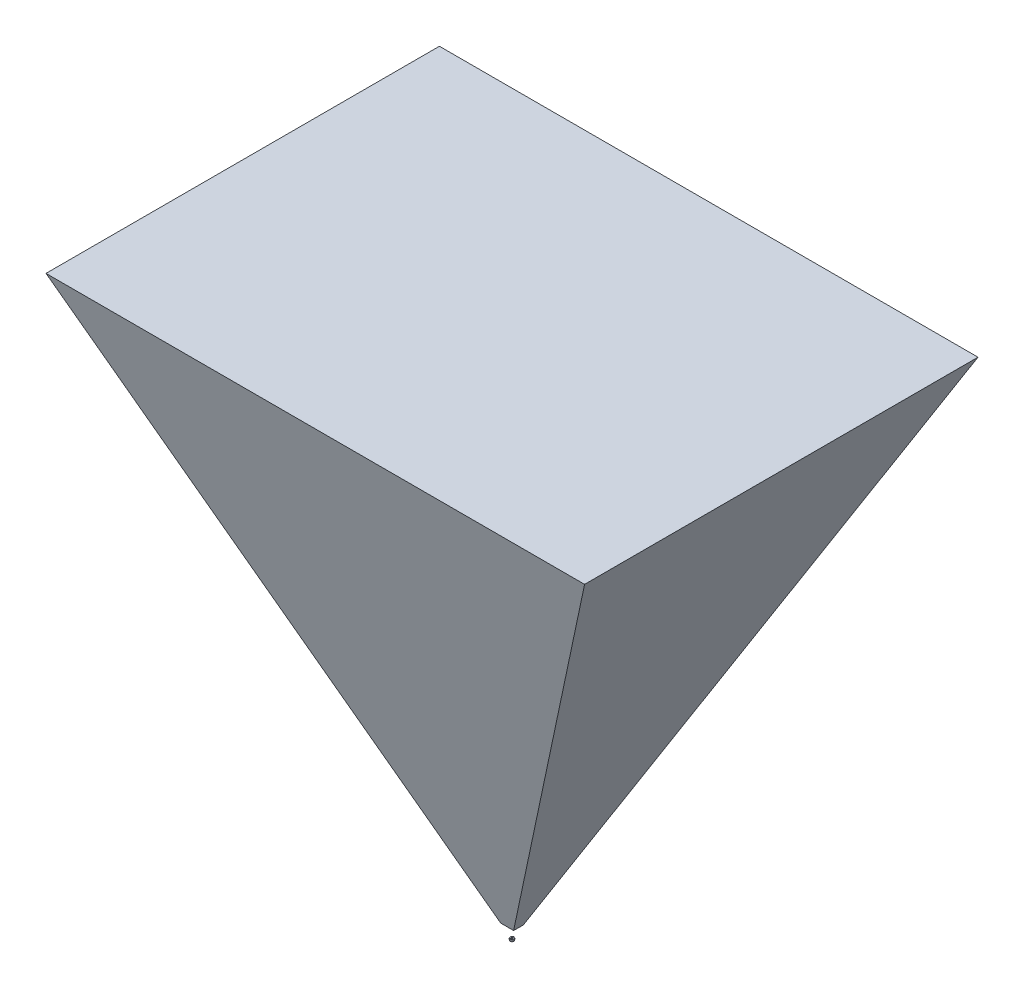
from build123d import *

# Parameters (mm, degrees)
SKIZZE4_W             = 0.25
SKIZZE4_H             = 1
TOOLFACE_ANGLE        = 60
KREISMUSTER1_COUNT    = 3
FOV_3_6MM_F_2_9_DEPTH = 500
FOV2_DEPTH            = 1005.668226736
FOV2_DEPTH_BACK       = 1005.668226736
SKIZZE8_OUTSIDE_W     = 1287.01
SKIZZE8_OUTSIDE_H     = 1108.268
SKIZZE8_OUTSIDE_R     = 5


with BuildPart() as part:
    # Skizze3 → Body (revolve)
    with BuildSketch(Plane.XY):
        with BuildLine():
            Line((1, 0.8), (2.75, 0.8))
            Line((2.75, 0.8), (2.75, -2.55))
            Line((2.75, -2.55), (2.1, -2.55))
            Line((2.1, -2.55), (1.8, -2.25))
            ThreePointArc((1.8, -2.25), (0.91241438, -2.474486277), (0, -2.55))
            Line((0, -2.55), (0, 0.525))
            ThreePointArc((0, 0.525), (0.316474723, 0.499842016), (0.625, 0.425))
            Line((0.625, 0.425), (1, 0.8))
        make_face()
    revolve(axis=Axis((0, 0, 0), (0, -1, 0)))

    # Skizze4 → Thread (revolve)
    with BuildSketch(Plane.XY):
        with Locations((2.875, -0.7)):
            Rectangle(SKIZZE4_W, SKIZZE4_H)
    revolve(axis=Axis((0, 0, 0), (0, 1, 0)))

    # Skizze5 → Toolface (revolve, cut)
    with BuildSketch(Plane(origin=(0, 0, 0), x_dir=(0, 0, -1), z_dir=(1, 0, 0))):
        Polygon((2.75, 0.8), (2.75, 0.35), (2.3, 0.8), align=None)
    toolface = revolve(axis=Axis((0, 0, 0), (0, -1, 0)), revolution_arc=TOOLFACE_ANGLE, mode=Mode.SUBTRACT)

    # Kreismuster1: Toolface ×3 about axis
    kreismuster1_axis = Axis((0, 0, 0), (0, 1, 0))
    for i in range(1, KREISMUSTER1_COUNT):
        add(toolface.rotate(kreismuster1_axis, i * 360 / KREISMUSTER1_COUNT), mode=Mode.SUBTRACT)


with BuildPart() as body_2:
    # Skizze6 → FOV - 3,6mm f/2,9 (new, symmetric)
    with BuildSketch(Plane(origin=(0, 0, 0), x_dir=(0, 0, -1), z_dir=(1, 0, 0))):
        Polygon((-7.279404685, 18.707826613), (-298.455592098, 818.707826613), (298.455592098, 818.707826613), (7.279404685, 18.707826613), align=None)
    extrude(amount=FOV_3_6MM_F_2_9_DEPTH, both=True)

    # Skizze8 outside → FOV2 (cut, two sides: drawn at the far end of the back side and taken through both)
    with BuildSketch(Plane.XY.offset(-FOV2_DEPTH_BACK)):
        with Locations((0, 408.079)):
            Rectangle(SKIZZE8_OUTSIDE_W, SKIZZE8_OUTSIDE_H)
        Circle(SKIZZE8_OUTSIDE_R, mode=Mode.SUBTRACT)
        Polygon((-9.740481092, 18.707826613), (-408.605767535, 818.707826613), (408.605767535, 818.707826613), (9.740481092, 18.707826613), align=None, mode=Mode.SUBTRACT)
    extrude(amount=FOV2_DEPTH + FOV2_DEPTH_BACK, mode=Mode.SUBTRACT)


solid = Compound([part.part, body_2.part])
